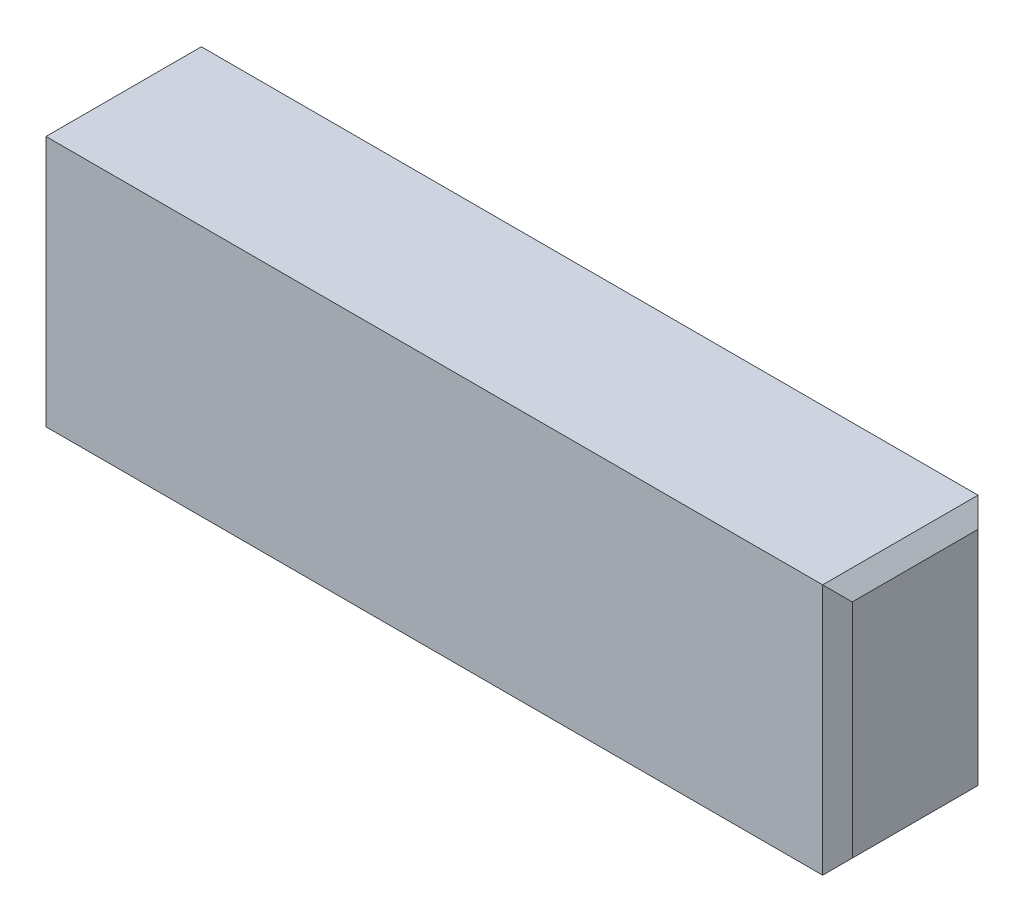
from build123d import *

# Parameters (mm, degrees)
SKETCH1_W           = 109
SKETCH1_H           = 34
BOSS_EXTRUDE1_DEPTH = 21
CHAMFER1_SIZE       = 2


with BuildPart() as part:
    # Sketch1 → Boss-Extrude1 (new body)
    with BuildSketch(Plane.XY):
        Rectangle(SKETCH1_W, SKETCH1_H)
    extrude(amount=BOSS_EXTRUDE1_DEPTH)

    # Chamfer1
    chamfer1_edges = [part.edges().sort_by_distance(p)[0] for p in [
        (-54.5, 17, 10.5),
        (-54.5, 0, 21),
        (-54.5, -17, 10.5),
        (-54.5, 0, 0),
        (54.5, -17, 10.5),
        (54.5, 0, 21),
        (54.5, 17, 10.5),
        (54.5, 0, 0),
    ]]
    chamfer(chamfer1_edges, length=CHAMFER1_SIZE)


solid = part.part
